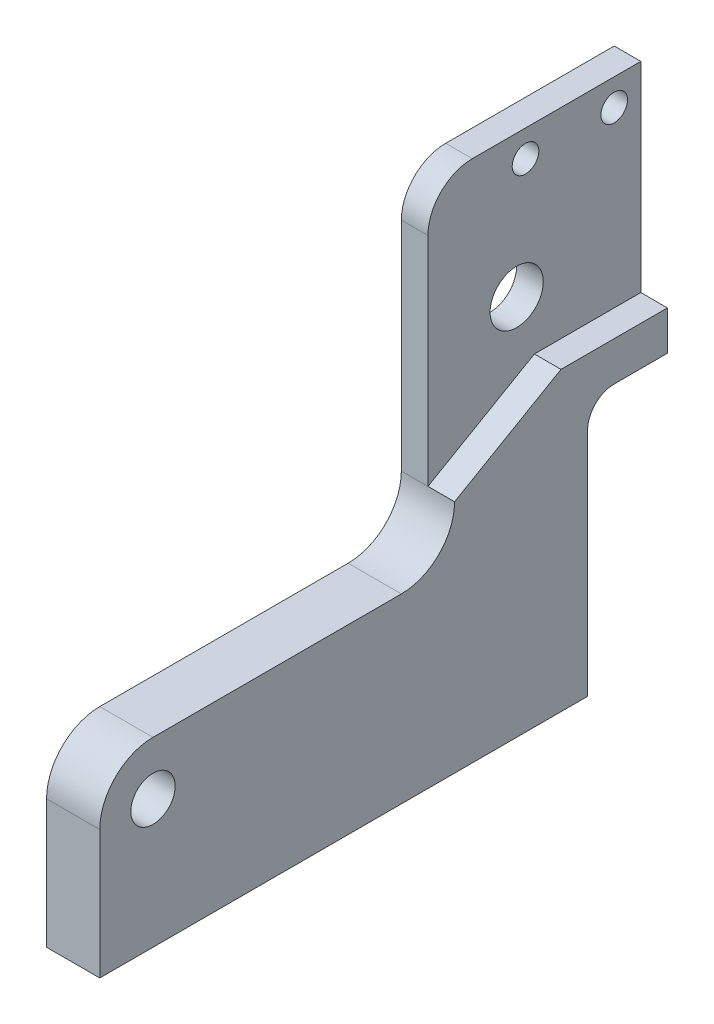
from build123d import *

# Parameters (mm, degrees)
SKETCH1_W                   = 64
SKETCH1_H                   = 56
SKETCH1_R                   = 2.5
SKETCH1_R_2                 = 3
BOSS_EXTRUDE1_DEPTH         = 6
CUT_EXTRUDE2_REACH          = 87.253
SKETCH3_W                   = 9
SKETCH3_H                   = 29
FILLET2_R                   = 3
TAP_DRILL_FOR_M3_TAP1_D     = 2.5
TAP_DRILL_FOR_M3_TAP1_DEPTH = 10
TAP_DRILL_FOR_M3_TAP1_TIP   = 0.751075774
CUT_EXTRUDE3_DEPTH          = 8
CUT_EXTRUDE4_DEPTH          = 3
FILLET3_R                   = 5
CUT_EXTRUDE5_REACH          = 87.094
SKETCH14_R                  = 1.5


with BuildPart() as part:
    # Sketch1 → Boss-Extrude1 (new body)
    with BuildSketch(Plane(origin=(0, 0, 0), x_dir=(0, 0, -1), z_dir=(1, 0, 0))):
        with Locations((32, 28)):
            Rectangle(SKETCH1_W, SKETCH1_H)
        with Locations((6, 14.5)):
            Circle(SKETCH1_R, mode=Mode.SUBTRACT)
        with Locations((50, 40)):
            Circle(SKETCH1_R_2, mode=Mode.SUBTRACT)
    extrude(amount=BOSS_EXTRUDE1_DEPTH)

    # Sketch3 → Cut-Extrude2 (cut, up to next)
    with BuildSketch(Plane(origin=(6, 0, 0), x_dir=(0, 0, -1), z_dir=(1, 0, 0)), mode=Mode.PRIVATE) as cut_extrude2_sk1:
        with Locations((59.5, 14.5)):
            Rectangle(SKETCH3_W, SKETCH3_H)
    cut_extrude2_tool1 = extrude(cut_extrude2_sk1.sketch, amount=-CUT_EXTRUDE2_REACH, mode=Mode.PRIVATE) & part.part
    add(cut_extrude2_tool1.solids().sort_by_distance((6, 14.5, -59.5))[0], mode=Mode.SUBTRACT)

    # Fillet2
    fillet2_edges = [part.edges().sort_by_distance(p)[0] for p in [
        (3, 29, -55),
    ]]
    fillet(fillet2_edges, radius=FILLET2_R)

    # Tap Drill for M3 Tap1
    with Locations(Plane(origin=(0, 0, 0), x_dir=(-1, 0, 0), z_dir=(0, -1, 0))):
        with Locations((-3, 48), (-3, 12)):
            Hole(TAP_DRILL_FOR_M3_TAP1_D / 2, depth=TAP_DRILL_FOR_M3_TAP1_DEPTH)
            with Locations((0, 0, -(TAP_DRILL_FOR_M3_TAP1_DEPTH + TAP_DRILL_FOR_M3_TAP1_TIP / 2))):  # 118° drill point
                Cone(0, TAP_DRILL_FOR_M3_TAP1_D / 2, TAP_DRILL_FOR_M3_TAP1_TIP, mode=Mode.SUBTRACT)

    # Sketch9 → Cut-Extrude3 (cut)
    with BuildSketch(Plane(origin=(6, 0, 0), x_dir=(0, 0, -1), z_dir=(1, 0, 0))):
        with BuildLine():
            Line((6, 20.5), (34, 20.5))
            ThreePointArc((34, 20.5), (38.242640687, 22.257359313), (40, 26.5))
            Line((40, 26.5), (40, 56))
            Line((40, 56), (0, 56))
            Line((0, 56), (0, 14.5))
            ThreePointArc((0, 14.5), (1.757359313, 18.742640687), (6, 20.5))
        make_face()
    extrude(amount=-CUT_EXTRUDE3_DEPTH, mode=Mode.SUBTRACT)

    # Sketch13 → Cut-Extrude4 (cut)
    with BuildSketch(Plane(origin=(6, 0, 0), x_dir=(0, 0, -1), z_dir=(1, 0, 0))):
        Polygon((52, 33.42820323), (64, 33.42820323), (64, 56), (40, 56), (40, 26.5), align=None)
    extrude(amount=-CUT_EXTRUDE4_DEPTH, mode=Mode.SUBTRACT)

    # Fillet3
    fillet3_edges = [part.edges().sort_by_distance(p)[0] for p in [
        (1.5, 56, -40),
    ]]
    fillet(fillet3_edges, radius=FILLET3_R)

    # Sketch14 → Cut-Extrude5 (cut, up to next)
    with BuildSketch(Plane(origin=(3, 0, 0), x_dir=(0, 0, -1), z_dir=(1, 0, 0)), mode=Mode.PRIVATE) as cut_extrude5_sk1:
        with Locations((61, 53)):
            Circle(SKETCH14_R)
    cut_extrude5_tool1 = extrude(cut_extrude5_sk1.sketch, amount=-CUT_EXTRUDE5_REACH, mode=Mode.PRIVATE) & part.part
    # Sketch14 → Cut-Extrude5 (cut, up to next)
    with BuildSketch(Plane(origin=(3, 0, 0), x_dir=(0, 0, -1), z_dir=(1, 0, 0)), mode=Mode.PRIVATE) as cut_extrude5_sk2:
        with Locations((51, 53)):
            Circle(SKETCH14_R)
    cut_extrude5_tool2 = extrude(cut_extrude5_sk2.sketch, amount=-CUT_EXTRUDE5_REACH, mode=Mode.PRIVATE) & part.part
    add(cut_extrude5_tool1.solids().sort_by_distance((3, 53, -61))[0], mode=Mode.SUBTRACT)
    add(cut_extrude5_tool2.solids().sort_by_distance((3, 53, -51))[0], mode=Mode.SUBTRACT)


solid = part.part
